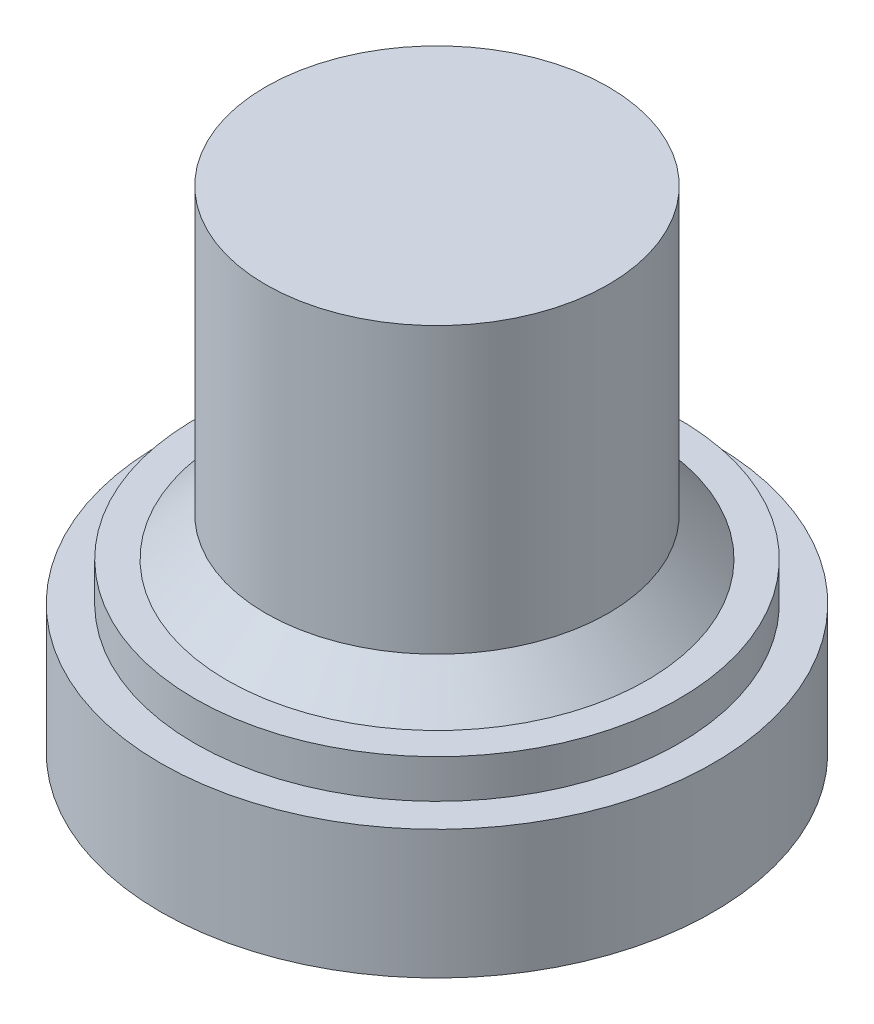
from build123d import *

# Parameters (mm, degrees)
SKETCH1_R           = 12.7
BOSS_EXTRUDE1_DEPTH = 5.9182
SKETCH3_R           = 11.1252
BOSS_EXTRUDE2_DEPTH = 1.778
SKETCH4_R           = 7.874
BOSS_EXTRUDE3_DEPTH = 14.859


with BuildPart() as part:
    # Sketch1 → Boss-Extrude1 (new body)
    with BuildSketch(Plane(origin=(0, 0, 0), x_dir=(1, 0, 0), z_dir=(0, 1, 0))):
        with Locations(Location((0, 0, 0), (0, 0, 270))):
            Circle(SKETCH1_R)
    extrude(amount=BOSS_EXTRUDE1_DEPTH)

    # Sketch3 → Boss-Extrude2 (add)
    with BuildSketch(Plane(origin=(0, 5.9182, 0), x_dir=(1, 0, 0), z_dir=(0, 1, 0))):
        with Locations(Location((0, 0, 0), (0, 0, 270))):
            Circle(SKETCH3_R)
    extrude(amount=BOSS_EXTRUDE2_DEPTH)

    # Sketch4 → Boss-Extrude3 (add)
    with BuildSketch(Plane(origin=(0, 7.6962, 0), x_dir=(1, 0, 0), z_dir=(0, 1, 0))):
        with Locations(Location((0, 0, 0), (0, 0, 270))):
            Circle(SKETCH4_R)
    extrude(amount=BOSS_EXTRUDE3_DEPTH)

    # Chamfer2: read off the stored shape, not the designer's step
    # Chamfer2 outline → Chamfer2 (revolve)
    with BuildSketch(Plane.XY):
        Polygon((9.652, 7.6962), (7.874, 9.4742), (7.874, 7.6962), align=None)
    revolve(axis=Axis((0, 0, 0), (0, 1, 0)))


solid = part.part
